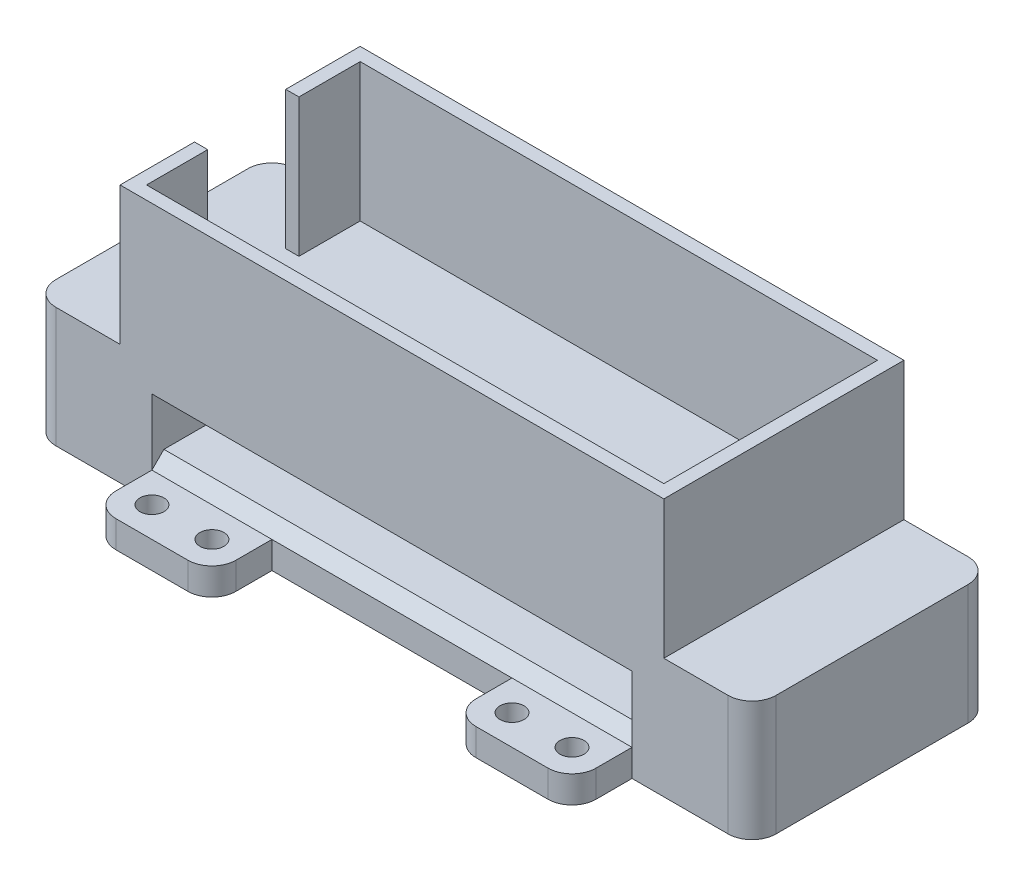
from build123d import *

# Parameters (mm, degrees)
SKETCH1_W            = 60
SKETCH1_H            = 20
BASE_DEPTH           = 10
SKETCH5_W            = 40
SKETCH5_H            = 3.5
CUT_EXTRUDE3_DEPTH   = 20
SKETCH6_W            = 40
SKETCH6_H            = 5
BOSS_EXTRUDE4_DEPTH  = 1
SKETCH8_W            = 40
SKETCH8_H            = 5
CUT_EXTRUDE6_DEPTH   = 1
CHAMFER2_SIZE        = 1
SKETCH13_W           = 45.3
SKETCH13_H           = 20
SKETCH13_W_2         = 43.1
SKETCH13_H_2         = 17.8
BOSS_EXTRUDE5_DEPTH  = 11.5
SKETCH14_W           = 3.171036328
SKETCH14_H           = 7.6
CUT_EXTRUDE11_DEPTH  = 11.5
FILLET2_R            = 2
SKETCH17_W           = 10
SKETCH17_H           = 2.25
BOSS_EXTRUDE7_DEPTH  = 5
SKETCH18_R           = 1
CUT_EXTRUDE12_DEPTH  = 2.25
FILLET3_R            = 2
FILLET3_OF_MIRROR6_R = 2
MIRROR7_OUTLINE_R    = 1
MIRROR7_DEPTH        = 2.25
SKETCH19_R           = 1
CUT_EXTRUDE13_DEPTH  = 0.6


# Read off the part's stored shape, not the designer's step: Mirror7
with BuildPart() as part:
    # Sketch1 → Base (new body)
    with BuildSketch(Plane(origin=(0, 0, 0), x_dir=(1, 0, 0), z_dir=(0, 1, 0))):
        Rectangle(SKETCH1_W, SKETCH1_H)
    extrude(amount=BASE_DEPTH)

    # Sketch5 → Cut-Extrude3 (cut)
    with BuildSketch(Plane(origin=(0, 0, -10), x_dir=(-1, 0, 0), z_dir=(0, 0, -1))):
        with Locations((0, 5)):
            Rectangle(SKETCH5_W, SKETCH5_H)
    extrude(amount=-CUT_EXTRUDE3_DEPTH, mode=Mode.SUBTRACT)

    # Sketch6 → Boss-Extrude4 (add)
    with BuildSketch(Plane(origin=(0, 3.25, 0), x_dir=(1, 0, 0), z_dir=(0, 1, 0))):
        Rectangle(SKETCH6_W, SKETCH6_H)
    extrude(amount=BOSS_EXTRUDE4_DEPTH)

    # Sketch8 → Cut-Extrude6 (cut)
    with BuildSketch(Plane.XZ.offset(-6.75)):
        Rectangle(SKETCH8_W, SKETCH8_H)
    extrude(amount=-CUT_EXTRUDE6_DEPTH, mode=Mode.SUBTRACT)

    # Chamfer2
    chamfer2_edges = [part.edges().sort_by_distance(p)[0] for p in [
        (0, 6.75, -2.5),
        (0, 6.75, 10),
        (0, 3.25, -2.5),
        (0, 3.25, 2.5),
        (0, 3.25, -10),
        (0, 6.75, -10),
        (0, 3.25, 10),
        (0, 6.75, 2.5),
    ]]
    chamfer(chamfer2_edges, length=CHAMFER2_SIZE - 0.0001)  # a hair under: the kernel refuses the full size

    # Sketch13 → Boss-Extrude5 (add)
    with BuildSketch(Plane(origin=(0, 10, 0), x_dir=(1, 0, 0), z_dir=(0, 1, 0))):
        Rectangle(SKETCH13_W, SKETCH13_H)
        Rectangle(SKETCH13_W_2, SKETCH13_H_2, mode=Mode.SUBTRACT)
    extrude(amount=BOSS_EXTRUDE5_DEPTH)

    # Sketch14 → Cut-Extrude11 (cut)
    with BuildSketch(Plane(origin=(0, 21.5, 0), x_dir=(1, 0, 0), z_dir=(0, 1, 0))):
        with Locations((-21.55, 0)):
            Rectangle(SKETCH14_W, SKETCH14_H)
    extrude(amount=-CUT_EXTRUDE11_DEPTH, mode=Mode.SUBTRACT)

    # Fillet2
    fillet2_edges = [part.edges().sort_by_distance(p)[0] for p in [
        (30, 5, 10),
        (-30, 5, 10),
        (-30, 5, -10),
        (30, 5, -10),
    ]]
    fillet(fillet2_edges, radius=FILLET2_R)

    # Sketch17 → Boss-Extrude7 (add)
    with BuildSketch(Plane.XY.offset(10)):
        with Locations((-15, 1.125)):
            Rectangle(SKETCH17_W, SKETCH17_H)
    boss_extrude7 = extrude(amount=BOSS_EXTRUDE7_DEPTH)

    # Sketch18 → Cut-Extrude12 (cut)
    with BuildSketch(Plane(origin=(0, 2.25, 0), x_dir=(1, 0, 0), z_dir=(0, 1, 0))):
        with Locations(Location((-17.5, -12.5, 0), (0, 0, 270))):
            Circle(SKETCH18_R)
        with Locations(Location((-12.5, -12.5, 0), (0, 0, 270))):
            Circle(SKETCH18_R)
    cut_extrude12 = extrude(amount=-CUT_EXTRUDE12_DEPTH, mode=Mode.SUBTRACT)

    # Fillet3
    fillet3_edges = [part.edges().sort_by_distance(p)[0] for p in [
        (-20, 1.125, 15),
        (-10, 1.125, 15),
    ]]
    fillet(fillet3_edges, radius=FILLET3_R)

    # Mirror6: Boss-Extrude7, Cut-Extrude12 across plane
    add(boss_extrude7.mirror(Plane(origin=(0, 0, 0), x_dir=(0, 0, 1), z_dir=(1, 0, 0))))
    add(cut_extrude12.mirror(Plane(origin=(0, 0, 0), x_dir=(0, 0, 1), z_dir=(1, 0, 0))), mode=Mode.SUBTRACT)

    # Fillet3 of Mirror6
    fillet3_of_mirror6_edges = [part.edges().sort_by_distance(p)[0] for p in [
        (20, 1.125, 15),
        (10, 1.125, 15),
    ]]
    fillet(fillet3_of_mirror6_edges, radius=FILLET3_OF_MIRROR6_R)

    # Mirror7 outline → Mirror7 (add)
    # profile 1 of 2: a face of its own
    with BuildSketch(Plane(origin=(0, 0, 0), x_dir=(1, 0, 0), z_dir=(0, 1, 0))):
        with BuildLine():
            ThreePointArc((-18, 15), (-19.414213562, 14.414213562), (-20, 13))
            Line((-20, 13), (-20, 10))
            Line((-20, 10), (-10, 10))
            Line((-10, 10), (-10, 13))
            ThreePointArc((-10, 13), (-10.585786438, 14.414213562), (-12, 15))
            Line((-12, 15), (-18, 15))
        make_face()
        with Locations((-17.5, 12.5)):
            Circle(MIRROR7_OUTLINE_R, mode=Mode.SUBTRACT)
        with Locations((-12.5, 12.5)):
            Circle(MIRROR7_OUTLINE_R, mode=Mode.SUBTRACT)
    # profile 2 of 2: a face of its own
    with BuildSketch(Plane(origin=(0, 0, 0), x_dir=(1, 0, 0), z_dir=(0, 1, 0))):
        with BuildLine():
            Line((10, 13), (10, 10))
            Line((10, 10), (20, 10))
            Line((20, 10), (20, 13))
            ThreePointArc((20, 13), (19.414213562, 14.414213562), (18, 15))
            Line((18, 15), (12, 15))
            ThreePointArc((12, 15), (10.585786438, 14.414213562), (10, 13))
        make_face()
        with Locations((12.5, 12.5)):
            Circle(MIRROR7_OUTLINE_R, mode=Mode.SUBTRACT)
        with Locations((17.5, 12.5)):
            Circle(MIRROR7_OUTLINE_R, mode=Mode.SUBTRACT)
    extrude(amount=MIRROR7_DEPTH)

    # Sketch19 → Cut-Extrude13 (cut)
    with BuildSketch(Plane.XZ):
        with Locations(Location((0, 0, 0), (0, 0, 270))):
            Circle(SKETCH19_R)
    extrude(amount=-CUT_EXTRUDE13_DEPTH, mode=Mode.SUBTRACT)


solid = part.part
